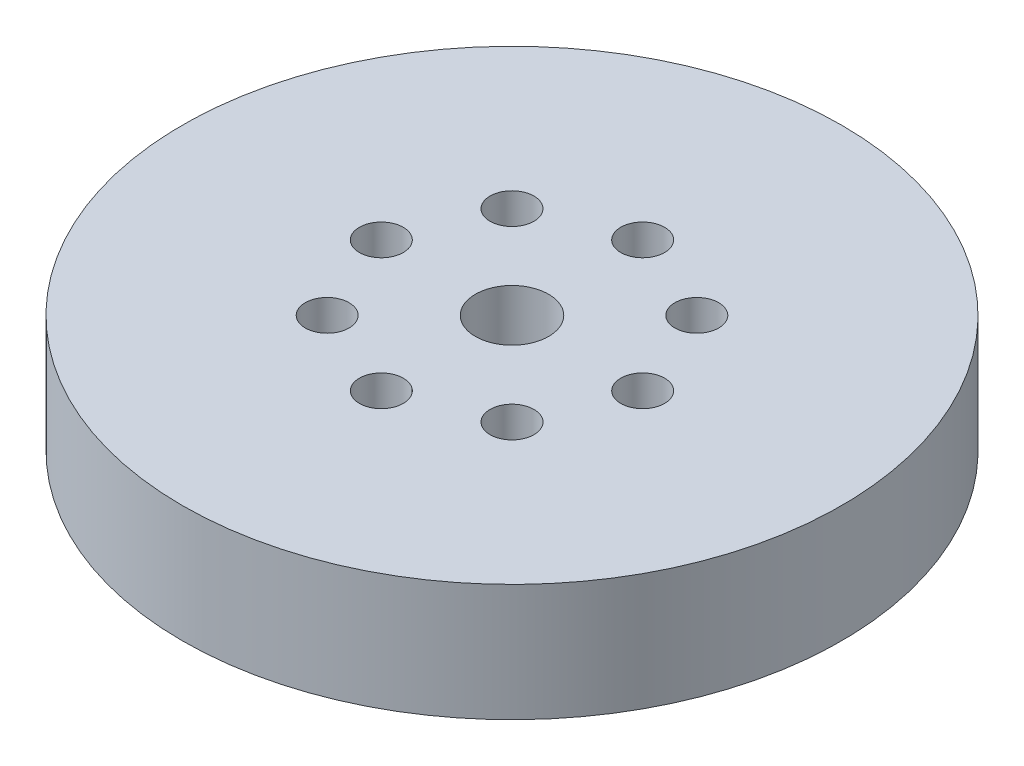
from build123d import *

# Parameters (mm, degrees)
SKETCH1_R           = 45
BOSS_EXTRUDE1_DEPTH = 16
SKETCH2_R           = 5
CUT_EXTRUDE1_DEPTH  = 66.620118866
SKETCH3_R           = 2.99490753
CUT_EXTRUDE2_DEPTH  = 10.111512661
CIRPATTERN1_COUNT   = 8


with BuildPart() as part:
    # Sketch1 → Boss-Extrude1 (new body)
    with BuildSketch(Plane(origin=(0, 0, 0), x_dir=(1, 0, 0), z_dir=(0, 1, 0))):
        Circle(SKETCH1_R)
    extrude(amount=BOSS_EXTRUDE1_DEPTH)

    # Sketch2 → Cut-Extrude1 (cut, through all)
    with BuildSketch(Plane(origin=(0, 0, 0), x_dir=(1, 0, 0), z_dir=(0, 1, 0))):
        Circle(SKETCH2_R)
    extrude(amount=CUT_EXTRUDE1_DEPTH, mode=Mode.SUBTRACT)

    # Sketch3 → Cut-Extrude2 (cut)
    with BuildSketch(Plane(origin=(0, 16, 0), x_dir=(1, 0, 0), z_dir=(0, 1, 0))):
        with Locations((-17.84440508, 0)):
            Circle(SKETCH3_R)
    cut_extrude2 = extrude(amount=-CUT_EXTRUDE2_DEPTH, mode=Mode.SUBTRACT)

    # CirPattern1: Cut-Extrude2 ×8 about axis
    cirpattern1_axis = Axis((0, 0, 0), (0, 1, 0))
    for i in range(1, CIRPATTERN1_COUNT):
        add(cut_extrude2.rotate(cirpattern1_axis, i * 360 / CIRPATTERN1_COUNT), mode=Mode.SUBTRACT)


solid = part.part
